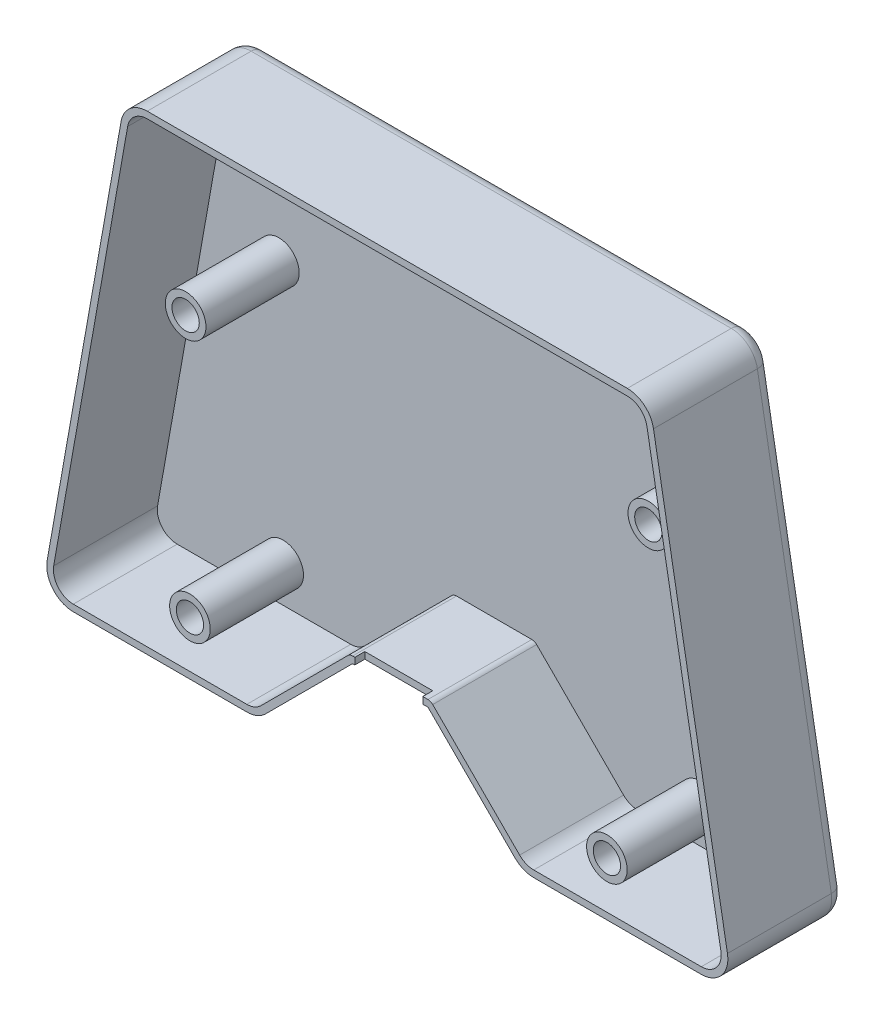
from build123d import *

# Parameters (mm, degrees)
EXTRUDE_1_DEPTH                    = 2
EXTRUDE_2_DEPTH                    = 14
EXTRUDE_3_DEPTH                    = 15.6000508
FILLET_1_R                         = 2
SKETCH_12_W                        = 10.2
SKETCH_12_H                        = 1.9
USB_TYPEC_LOWER_HALF_OPENING_DEPTH = 4


with BuildPart() as part:
    # 草图1 → 凸台-拉伸1 (new body)
    with BuildSketch(Plane.XY):
        with BuildLine():
            Line((-18.736989068, -43.807492656), (7.319785463, -43.807492656))
            ThreePointArc((7.319785463, -43.807492656), (8.845661337, -43.503976443), (10.139236063, -42.639636403))
            Line((10.139236063, -42.639636403), (23.19168867, -29.587186336))
            ThreePointArc((23.19168867, -29.587186336), (23.195810689, -29.58443157), (23.200673199, -29.583464208))
            Line((23.200673199, -29.583464208), (34.512272144, -29.583464208))
            ThreePointArc((34.512272144, -29.583464208), (34.51713329, -29.584431533), (34.521254362, -29.587185298))
            Line((34.521254362, -29.587185298), (47.573709045, -42.639637441))
            ThreePointArc((47.573709045, -42.639637441), (48.867282822, -43.503976481), (50.393157333, -43.807492656))
            Line((50.393157333, -43.807492656), (75.552353414, -43.807492656))
            ThreePointArc((75.552353414, -43.807492656), (78.607819066, -42.38196989), (79.478533005, -39.124694535))
            Line((79.478533005, -39.124694535), (68.376081771, 23.550429382))
            ThreePointArc((68.376081771, 23.550429382), (67.011684276, 25.910401612), (64.449902577, 26.842240644))
            Line((64.449902577, 26.842240644), (-7.634537883, 26.842240644))
            ThreePointArc((-7.634537883, 26.842240644), (-10.196320099, 25.910401179), (-11.560717313, 23.550428053))
            Line((-11.560717313, 23.550428053), (-22.663168183, -39.124693813))
            ThreePointArc((-22.663168183, -39.124693813), (-21.792454719, -42.381969476), (-18.736989068, -43.807492656))
        make_face()
    extrude(amount=EXTRUDE_1_DEPTH)

    # 草图4 → 凸台-拉伸2 (add)
    # profile 1 of 4: a face of its own
    with BuildSketch(Plane.XY.offset(2)):
        with BuildLine():
            ThreePointArc((-5.872384963, -37.375183791), (-2.822381153, -40.425187601), (0.227622657, -37.375183791))
            ThreePointArc((0.227622657, -37.375183791), (-2.822381153, -34.325179981), (-5.872384963, -37.375183791))
        make_face()
        with BuildLine():
            ThreePointArc((-0.772377343, -37.375183791), (-2.822381153, -35.325179981), (-4.872384963, -37.375183791))
            ThreePointArc((-4.872384963, -37.375183791), (-2.822381153, -39.425187601), (-0.772377343, -37.375183791))
        make_face(mode=Mode.SUBTRACT)
    # profile 2 of 4: a face of its own
    with BuildSketch(Plane.XY.offset(2)):
        with BuildLine():
            ThreePointArc((56.727742037, -37.375183791), (59.777745847, -40.425187601), (62.827749657, -37.375183791))
            ThreePointArc((62.827749657, -37.375183791), (59.777745847, -34.325179981), (56.727742037, -37.375183791))
        make_face()
        with BuildLine():
            ThreePointArc((61.827749657, -37.375183791), (59.777745847, -35.325179981), (57.727742037, -37.375183791))
            ThreePointArc((57.727742037, -37.375183791), (59.777745847, -39.425187601), (61.827749657, -37.375183791))
        make_face(mode=Mode.SUBTRACT)
    # profile 3 of 4: a face of its own
    with BuildSketch(Plane.XY.offset(2)):
        with BuildLine():
            ThreePointArc((69.049761341, 9.106909173), (65.999757531, 12.156912983), (62.949753721, 9.106909173))
            ThreePointArc((62.949753721, 9.106909173), (65.999757531, 6.056905363), (69.049761341, 9.106909173))
        make_face()
        with BuildLine():
            ThreePointArc((63.949753721, 9.106909173), (65.999757531, 7.056905363), (68.049761341, 9.106909173))
            ThreePointArc((68.049761341, 9.106909173), (65.999757531, 11.156912983), (63.949753721, 9.106909173))
        make_face(mode=Mode.SUBTRACT)
    # profile 4 of 4: a face of its own
    with BuildSketch(Plane.XY.offset(2)):
        with BuildLine():
            ThreePointArc((-6.519385217, 1.613894187), (-3.469381407, -1.436109623), (-0.419377597, 1.613894187))
            ThreePointArc((-0.419377597, 1.613894187), (-3.469381407, 4.663897997), (-6.519385217, 1.613894187))
        make_face()
        with BuildLine():
            ThreePointArc((-1.419377597, 1.613894187), (-3.469381407, 3.663897997), (-5.519385217, 1.613894187))
            ThreePointArc((-5.519385217, 1.613894187), (-3.469381407, -0.436109623), (-1.419377597, 1.613894187))
        make_face(mode=Mode.SUBTRACT)
    extrude(amount=EXTRUDE_2_DEPTH)

    # 草图6 → 凸台-拉伸3 (add)
    with BuildSketch(Plane.XY.offset(2)):
        with BuildLine():
            Line((-11.560717313, 23.550428053), (-22.663168183, -39.124693813))
            ThreePointArc((-22.663168183, -39.124693813), (-21.792454719, -42.381969476), (-18.736989068, -43.807492656))
            Line((-18.736989068, -43.807492656), (7.319785463, -43.807492656))
            ThreePointArc((7.319785463, -43.807492656), (8.845661337, -43.503976443), (10.139236063, -42.639636403))
            Line((10.139236063, -42.639636403), (23.19168867, -29.587186337))
            ThreePointArc((23.19168867, -29.587186337), (23.195810689, -29.58443157), (23.200673199, -29.583464208))
            Line((23.200673199, -29.583464208), (34.512272144, -29.583464208))
            ThreePointArc((34.512272144, -29.583464208), (34.51713329, -29.584431533), (34.521254362, -29.587185298))
            Line((34.521254362, -29.587185298), (47.573709045, -42.639637441))
            ThreePointArc((47.573709045, -42.639637441), (48.867282822, -43.503976481), (50.393157333, -43.807492656))
            Line((50.393157333, -43.807492656), (75.552353414, -43.807492656))
            ThreePointArc((75.552353414, -43.807492656), (78.607819066, -42.38196989), (79.478533005, -39.124694535))
            Line((79.478533005, -39.124694535), (68.376081771, 23.550429382))
            ThreePointArc((68.376081771, 23.550429382), (67.011684276, 25.910401612), (64.449902577, 26.842240644))
            Line((64.449902577, 26.842240644), (-7.634537883, 26.842240644))
            ThreePointArc((-7.634537883, 26.842240644), (-10.196320099, 25.910401179), (-11.560717313, 23.550428053))
        make_face()
        with BuildLine():
            Line((-10.576047254, 23.376000774), (-21.678498124, -39.299121091))
            ThreePointArc((-21.678498124, -39.299121091), (-21.026156001, -41.739485021), (-18.736988894, -42.807492656))
            Line((-18.736988894, -42.807492656), (7.319785463, -42.807492656))
            ThreePointArc((7.319785463, -42.807492656), (8.462977611, -42.580097033), (9.432128831, -41.932530072))
            Line((9.432128831, -41.932530072), (22.484540842, -28.880120606))
            ThreePointArc((22.484540842, -28.880120606), (22.813100147, -28.660563268), (23.200672562, -28.583464208))
            Line((23.200672562, -28.583464208), (34.512322586, -28.58346421))
            ThreePointArc((34.512322586, -28.58346421), (34.899840317, -28.660561774), (35.228361593, -28.880078967))
            Line((35.228361593, -28.880078967), (48.280815757, -41.932530591))
            ThreePointArc((48.280815757, -41.932530591), (49.249966503, -42.580097051), (50.393157969, -42.807492656))
            Line((50.393157969, -42.807492656), (75.552353414, -42.807492656))
            ThreePointArc((75.552353414, -42.807492656), (77.841520522, -41.739485228), (78.493862882, -39.299121453))
            Line((78.493862882, -39.299121453), (67.391411713, 23.376002103))
            ThreePointArc((67.391411713, 23.376002103), (66.369199703, 25.144102993), (64.449902443, 25.842240644))
            Line((64.449902443, 25.842240644), (-7.634537883, 25.842240644))
            ThreePointArc((-7.634537883, 25.842240644), (-9.553835577, 25.144102517), (-10.576047254, 23.376000774))
        make_face(mode=Mode.SUBTRACT)
    extrude(amount=EXTRUDE_3_DEPTH)

    # 圆角1
    fillet_1_edges = [part.edges().sort_by_distance(p)[0] for p in [
        (28.407682347, 26.842240644, 0),
        (67.011684276, 25.910401612, 0),
        (73.927307388, -7.787132577, 0),
        (78.607819066, -42.38196989, 0),
        (62.972755373, -43.807492656, 0),
        (48.867282822, -43.503976481, 0),
        (41.047481703, -36.11341137, 0),
        (34.51713329, -29.584431533, 0),
        (28.856472671, -29.583464208, 0),
        (23.195810689, -29.58443157, 0),
        (16.665462366, -36.11341137, 0),
        (8.845661337, -43.503976443, 0),
        (-5.708601803, -43.807492656, 0),
        (-21.792454719, -42.381969476, 0),
        (-17.111942748, -7.78713288, 0),
        (-10.196320099, 25.910401179, 0),
    ]]
    fillet(fillet_1_edges, radius=FILLET_1_R - 0.0001)  # a hair under: the kernel refuses the full size

    # 草图12 → USB_TypeC_Lower_Half_Opening (cut)
    with BuildSketch(Plane.XZ.offset(29.583464208)):
        with Locations((28.634, 17.05)):
            Rectangle(SKETCH_12_W, SKETCH_12_H)
    extrude(amount=-USB_TYPEC_LOWER_HALF_OPENING_DEPTH, mode=Mode.SUBTRACT)


solid = part.part
